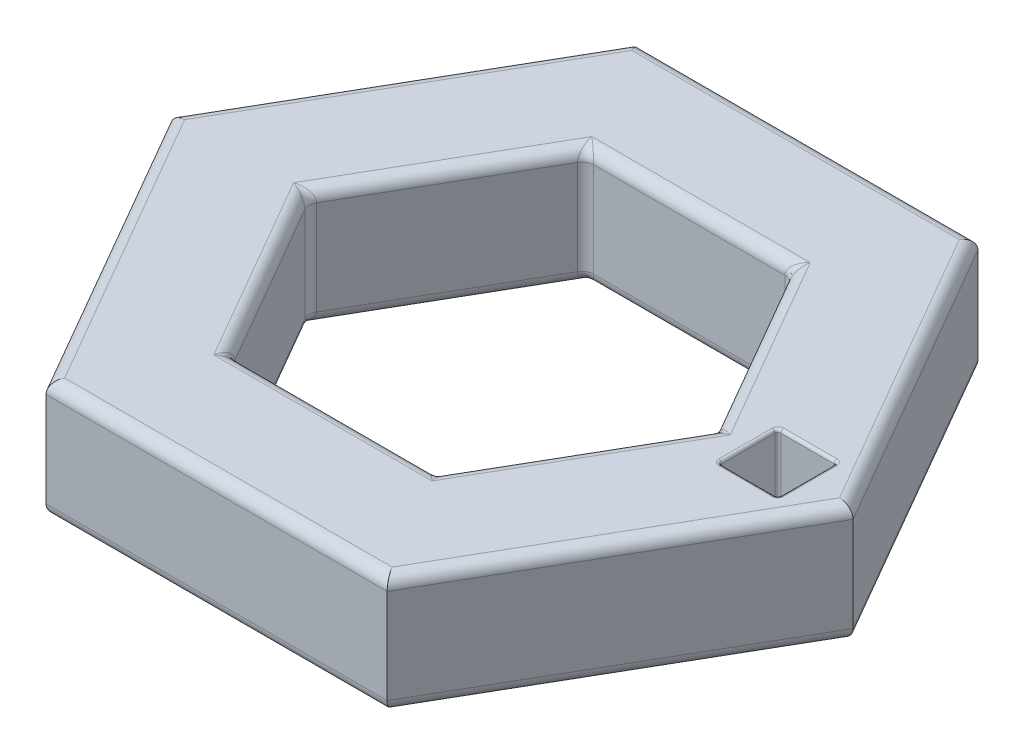
from build123d import *

# Parameters (mm, degrees)
BOSS_EXTRUDE1_DEPTH = 10
FILLET1_R           = 1
FILLET2_R           = 1
SKETCH2_W           = 5
SKETCH2_H           = 5
CUT_EXTRUDE1_DEPTH  = 40.475730967
FILLET3_R           = 0.25


with BuildPart() as part:
    # Sketch1 → Boss-Extrude1 (new body)
    with BuildSketch(Plane.XZ.offset(10)):
        Polygon((14.43375673, -25), (28.86751346, 0), (14.43375673, 25), (-14.43375673, 25), (-28.86751346, 0), (-14.43375673, -25), align=None)
        Polygon((-8.660254038, -15), (8.660254038, -15), (17.320508076, 0), (8.660254038, 15), (-8.660254038, 15), (-17.320508076, 0), align=None, mode=Mode.SUBTRACT)
    extrude(amount=-BOSS_EXTRUDE1_DEPTH)

    # Fillet1
    fillet1_edges = [part.edges().sort_by_distance(p)[0] for p in [
        (0, -10, -15),
        (12.990381057, -10, -7.5),
        (12.990381057, -10, 7.5),
        (0, -10, 15),
        (-12.990381057, -10, 7.5),
        (-12.990381057, -10, -7.5),
        (-21.650635095, -10, -12.5),
        (-21.650635095, -10, 12.5),
        (0, -10, 25),
        (21.650635095, -10, 12.5),
        (21.650635095, -10, -12.5),
        (0, -10, -25),
        (0, 0, 15),
        (12.990381057, 0, 7.5),
        (12.990381057, 0, -7.5),
        (0, 0, -15),
        (-12.990381057, 0, -7.5),
        (-12.990381057, 0, 7.5),
        (21.650635095, 0, -12.5),
        (21.650635095, 0, 12.5),
        (0, 0, 25),
        (-21.650635095, 0, 12.5),
        (-21.650635095, 0, -12.5),
        (0, 0, -25),
    ]]
    fillet(fillet1_edges, radius=FILLET1_R)

    # Fillet2
    fillet2_edges = [part.edges().sort_by_distance(p)[0] for p in [
        (-8.844181046, -0.268115848, 15.318570922),
        (-8.844181046, -9.731884152, 15.318570922),
        (8.844181046, -0.268115848, 15.318570922),
        (8.844181046, -9.731884152, 15.318570922),
        (17.688362091, -0.268115848, 0),
        (17.688362091, -9.731884152, 0),
        (8.844181046, -0.268115848, -15.318570922),
        (8.844181046, -9.731884152, -15.318570922),
        (-8.844181046, -0.268115848, -15.318570922),
        (-8.844181046, -9.731884152, -15.318570922),
        (-17.688362091, -0.268115848, 0),
        (-17.688362091, -9.731884152, 0),
        (-8.660254038, -5, 15),
        (8.660254038, -5, 15),
        (17.320508076, -5, 0),
        (8.660254038, -5, -15),
        (-8.660254038, -5, -15),
        (-17.320508076, -5, 0),
    ]]
    fillet(fillet2_edges, radius=FILLET2_R)

    # Sketch2 → Cut-Extrude1 (cut, through all)
    with BuildSketch(Plane(origin=(0, 0, 0), x_dir=(-1, 0, 0), z_dir=(0, 1, 0))):
        with Locations((-22.5, 0)):
            Rectangle(SKETCH2_W, SKETCH2_H)
    extrude(amount=-CUT_EXTRUDE1_DEPTH, mode=Mode.SUBTRACT)

    # Fillet3
    fillet3_edges = [part.edges().sort_by_distance(p)[0] for p in [
        (25, 0, 0),
        (22.5, 0, -2.5),
        (22.5, 0, 2.5),
        (20, 0, 0),
        (25, -10, 0),
        (22.5, -10, -2.5),
        (22.5, -10, 2.5),
        (20, -10, 0),
        (20, -5, 2.5),
        (20, -5, -2.5),
        (25, -5, -2.5),
        (25, -5, 2.5),
    ]]
    fillet(fillet3_edges, radius=FILLET3_R)


solid = part.part
